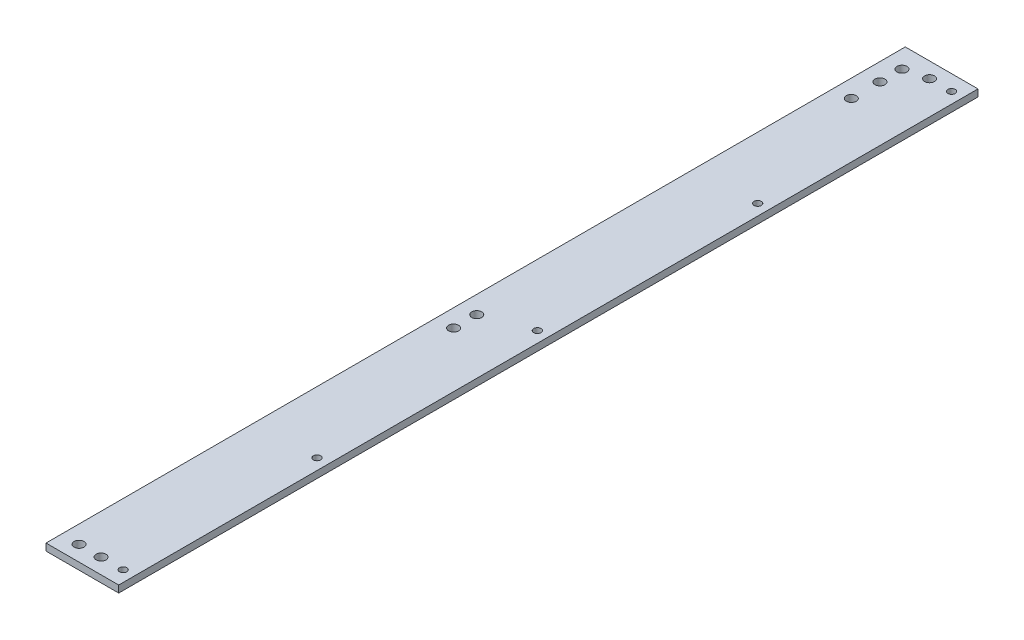
from build123d import *

# Parameters (mm, degrees)
SKETCH1_W             = 33
SKETCH1_H             = 390
BOSS_EXTRUDE1_DEPTH   = 3.175
M4_CLEARANCE_HOLE1_D  = 4.5
M4X0_7_TAPPED_HOLE1_D = 3.3


with BuildPart() as part:
    # Sketch1 → Boss-Extrude1 (new body)
    with BuildSketch(Plane(origin=(0, 0, 0), x_dir=(1, 0, 0), z_dir=(0, 1, 0))):
        Rectangle(SKETCH1_W, SKETCH1_H)
    extrude(amount=BOSS_EXTRUDE1_DEPTH)

    # M4 Clearance Hole1 (through all)
    with Locations(Plane(origin=(0, 3.175, 0), x_dir=(1, 0, 0), z_dir=(0, 1, 0))):
        with Locations((1.5, 188), (-8.5, 185.5), (-8.5, 175.5), (-8.5, 162.5), (-8.5, -7.5), (-8.5, -18), (-8.5, -188), (1.5, -188)):
            Hole(M4_CLEARANCE_HOLE1_D / 2)

    # M4x0.7 Tapped Hole1 (through all)
    with Locations(Plane(origin=(0, 3.175, 0), x_dir=(1, 0, 0), z_dir=(0, 1, 0))):
        with Locations((11.5, 188), (11.5, -188), (11.5, 100), (11.5, -100), (11.5, 0)):
            Hole(M4X0_7_TAPPED_HOLE1_D / 2)


solid = part.part
